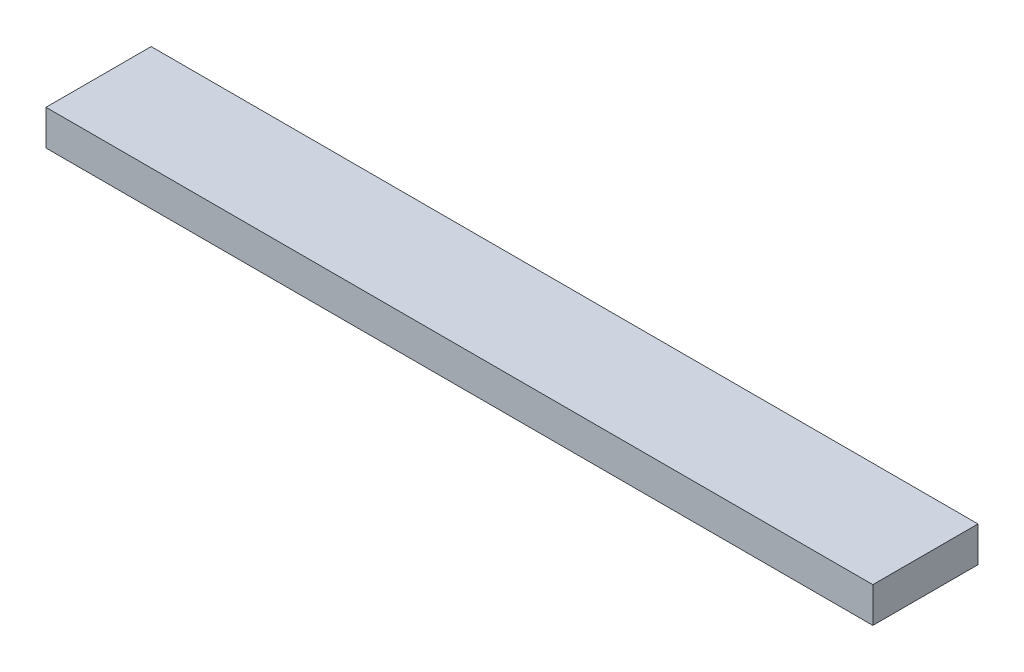
from build123d import *

# Parameters (mm, degrees)
SKETCH_1_W          = 515
SKETCH_1_H          = 135
EXTRUDE_1_DEPTH     = 22
SKETCH_2_W          = 515
SKETCH_2_H          = 69.5
CUT_EXTRUDE_1_DEPTH = 268.107656199


with BuildPart() as part:
    # Эскиз1 → Бобышка-Вытянуть1 (new body)
    with BuildSketch(Plane(origin=(0, 0, 0), x_dir=(1, 0, 0), z_dir=(0, 1, 0))):
        Rectangle(SKETCH_1_W, SKETCH_1_H)
    extrude(amount=EXTRUDE_1_DEPTH)

    # Эскиз2 → Вырез-Вытянуть1 (cut, through all)
    with BuildSketch(Plane(origin=(0, 22, 0), x_dir=(1, 0, 0), z_dir=(0, 1, 0))):
        with Locations((0, -32.75)):
            Rectangle(SKETCH_2_W, SKETCH_2_H)
    extrude(amount=-CUT_EXTRUDE_1_DEPTH, mode=Mode.SUBTRACT)


solid = part.part
